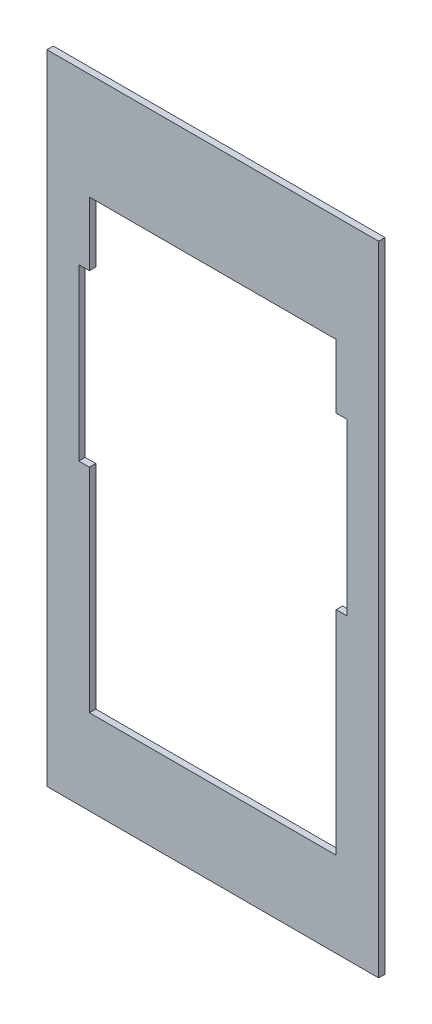
from build123d import *

# Parameters (mm, degrees)
SKETCH1_W           = 78
SKETCH1_H           = 150
BOSS_EXTRUDE1_DEPTH = 1.5


with BuildPart() as part:
    # Sketch1 → Boss-Extrude1 (new body)
    with BuildSketch(Plane.XY):
        Rectangle(SKETCH1_W, SKETCH1_H)
        Polygon((29, 50), (-29, 50), (-29, 35), (-31.5, 35), (-31.5, -5), (-29, -5), (-29, -55), (29, -55), (29, -5), (31.5, -5), (31.5, 35), (29, 35), align=None, mode=Mode.SUBTRACT)
    extrude(amount=BOSS_EXTRUDE1_DEPTH)


solid = part.part
